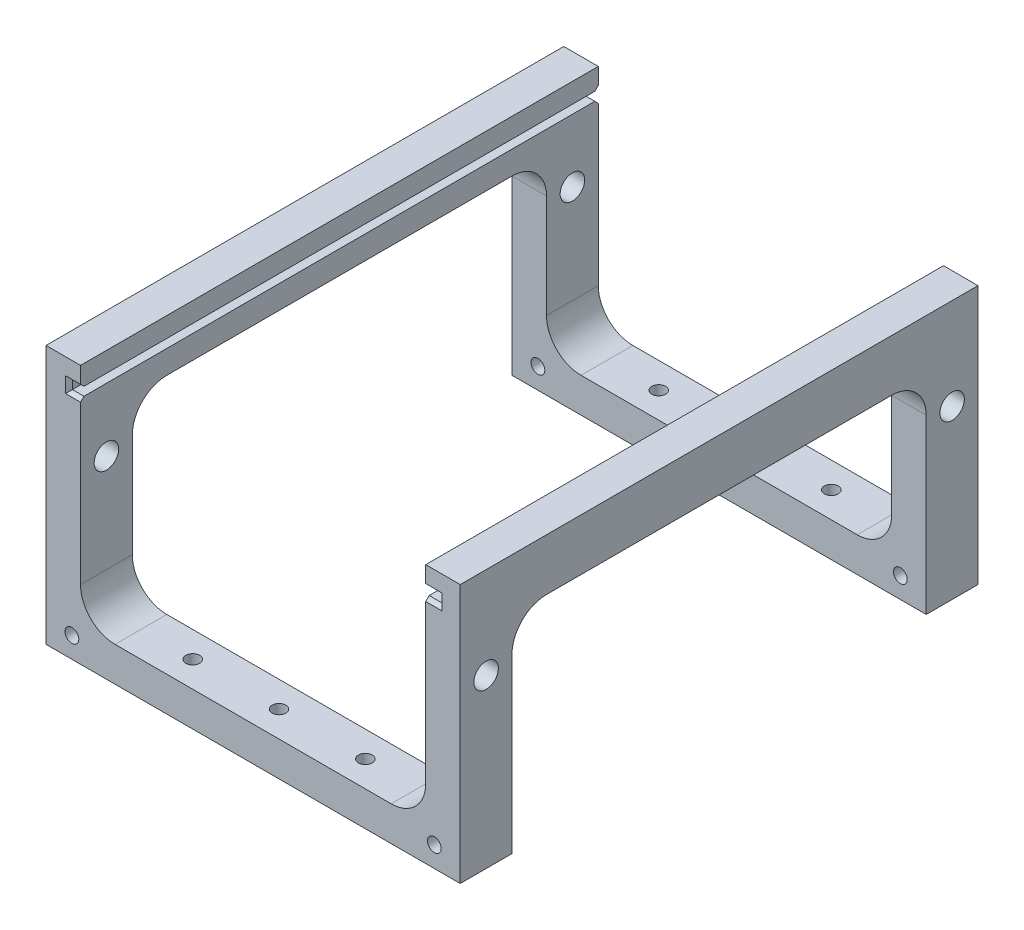
from build123d import *

# Parameters (mm, degrees)
SKETCH1_W           = 120
SKETCH1_H           = 150
BOSS_EXTRUDE1_DEPTH = 75
SKETCH3_W           = 107
SKETCH3_H           = 2.5
CUT_EXTRUDE2_DEPTH  = 179.115131306
SKETCH2_W           = 100
SKETCH2_H           = 150
CUT_EXTRUDE1_DEPTH  = 65
FILLET1_R           = 10
SKETCH4_R           = 2
CUT_EXTRUDE3_DEPTH  = 116.974135047
SKETCH5_R           = 2
CUT_EXTRUDE4_DEPTH  = 179.115131306
SKETCH6_R           = 3.55
CUT_EXTRUDE5_DEPTH  = 161.15617378
CHAMFER1_SIZE       = 1
SKETCH7_W           = 120
SKETCH7_H           = 60
CUT_EXTRUDE6_DEPTH  = 161.15617378
FILLET2_R           = 10


with BuildPart() as part:
    # Sketch1 → Boss-Extrude1 (new body)
    with BuildSketch(Plane(origin=(0, 0, 0), x_dir=(1, 0, 0), z_dir=(0, 1, 0))):
        Rectangle(SKETCH1_W, SKETCH1_H)
    extrude(amount=BOSS_EXTRUDE1_DEPTH)

    # Sketch3 → Cut-Extrude2 (cut, through all)
    with BuildSketch(Plane.XY.offset(75)):
        with Locations((0.15445013, 68)):
            Rectangle(SKETCH3_W, SKETCH3_H)
    extrude(amount=-CUT_EXTRUDE2_DEPTH, mode=Mode.SUBTRACT)

    # Sketch2 → Cut-Extrude1 (cut)
    with BuildSketch(Plane(origin=(0, 75, 0), x_dir=(1, 0, 0), z_dir=(0, 1, 0))):
        Rectangle(SKETCH2_W, SKETCH2_H)
    extrude(amount=-CUT_EXTRUDE1_DEPTH, mode=Mode.SUBTRACT)

    # Fillet1
    fillet1_edges = [part.edges().sort_by_distance(p)[0] for p in [
        (-50, 10, 0),
        (50, 10, 0),
    ]]
    fillet(fillet1_edges, radius=FILLET1_R)

    # Sketch4 → Cut-Extrude3 (cut, through all)
    with BuildSketch(Plane(origin=(0, 10, 0), x_dir=(1, 0, 0), z_dir=(0, 1, 0))):
        with Locations((0, 67.5)):
            Circle(SKETCH4_R)
        with Locations((25, 67.5)):
            Circle(SKETCH4_R)
        with Locations((-25, 67.5)):
            Circle(SKETCH4_R)
        with Locations((-25, -67.5)):
            Circle(SKETCH4_R)
        with Locations((25, -67.5)):
            Circle(SKETCH4_R)
        with Locations((0, -67.5)):
            Circle(SKETCH4_R)
    extrude(amount=-CUT_EXTRUDE3_DEPTH, mode=Mode.SUBTRACT)

    # Sketch5 → Cut-Extrude4 (cut, through all)
    with BuildSketch(Plane.XY.offset(75)):
        with Locations((-52.5, 6)):
            Circle(SKETCH5_R)
        with Locations((52.5, 6)):
            Circle(SKETCH5_R)
    extrude(amount=-CUT_EXTRUDE4_DEPTH, mode=Mode.SUBTRACT)

    # Sketch6 → Cut-Extrude5 (cut, through all)
    with BuildSketch(Plane(origin=(60, 0, 0), x_dir=(0, 0, -1), z_dir=(1, 0, 0))):
        with Locations((67.5, 48.5)):
            Circle(SKETCH6_R)
        with Locations((-67.5, 48.5)):
            Circle(SKETCH6_R)
    extrude(amount=-CUT_EXTRUDE5_DEPTH, mode=Mode.SUBTRACT)

    # Chamfer1
    chamfer1_edges = [part.edges().sort_by_distance(p)[0] for p in [
        (51.827225065, 69.25, 75),
        (53.65445013, 68, 75),
        (51.827225065, 66.75, 75),
        (51.827225065, 66.75, -75),
        (53.65445013, 68, -75),
        (51.827225065, 69.25, -75),
        (-51.672774935, 66.75, -75),
        (-51.672774935, 69.25, -75),
        (-53.34554987, 68, -75),
        (-51.672774935, 66.75, 75),
        (-51.672774935, 69.25, 75),
        (-53.34554987, 68, 75),
    ]]
    chamfer(chamfer1_edges, length=CHAMFER1_SIZE)

    # Sketch7 → Cut-Extrude6 (cut, through all)
    with BuildSketch(Plane(origin=(60, 0, 0), x_dir=(0, 0, -1), z_dir=(1, 0, 0))):
        with Locations((0, 30)):
            Rectangle(SKETCH7_W, SKETCH7_H)
    extrude(amount=-CUT_EXTRUDE6_DEPTH, mode=Mode.SUBTRACT)

    # Fillet2
    fillet2_edges = [part.edges().sort_by_distance(p)[0] for p in [
        (55, 60, -60),
        (-55, 60, -60),
        (-55, 60, 60),
        (55, 60, 60),
    ]]
    fillet(fillet2_edges, radius=FILLET2_R)


solid = part.part
